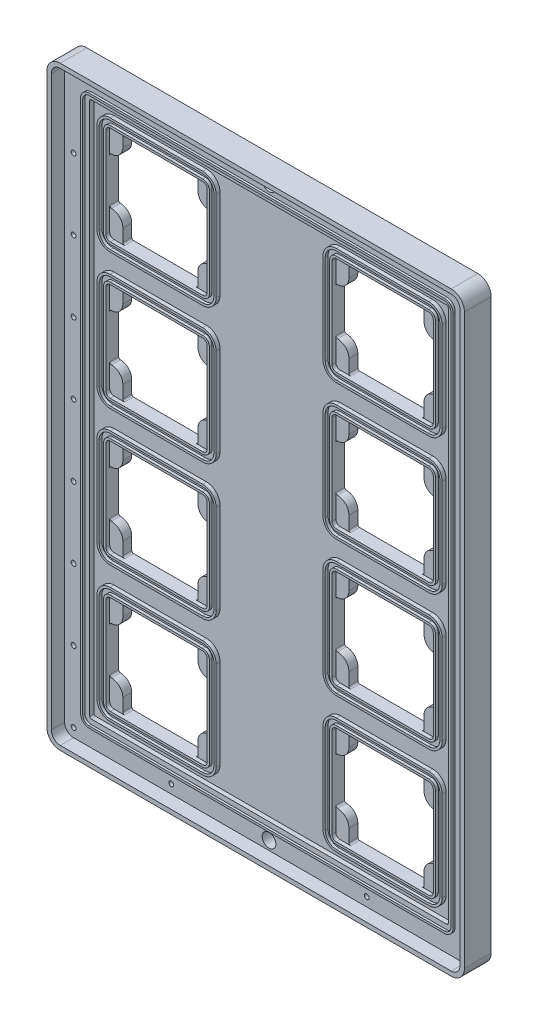
from build123d import *

# Parameters (mm, degrees)
SKETCH1_W            = 292.1
SKETCH1_H            = 419.1
BOSS_EXTRUDE1_DEPTH  = 9.525
SKETCH4_R            = 1.7272
CUT_EXTRUDE1_DEPTH   = 6.985
LPATTERN2_COUNT      = 8
LPATTERN2_PITCH      = 50.8
LPATTERN3_COUNT      = 4
LPATTERN3_PITCH      = 69.85
CUT_EXTRUDE3_DEPTH   = 3.175
BOSS_EXTRUDE2_DEPTH  = 1.5875
SKETCH7_R            = 4.9022
CUT_EXTRUDE4_DEPTH   = 511.938299235
FILLET1_R            = 6.35
CUT_EXTRUDE5_DEPTH   = 3.175
CUT_EXTRUDE6_DEPTH   = 511.970358882
SKETCH11_R           = 1.1303
CUT_EXTRUDE7_DEPTH   = 3.96875
BOSS_EXTRUDE3_DEPTH  = 2.794
BOSS_EXTRUDE4_DEPTH  = 0.79375
LPATTERN1_COUNT      = 2
LPATTERN1_PITCH      = 161.5948
LPATTERN1_COUNT_DIR2 = 4
LPATTERN1_PITCH_DIR2 = 96.8756
BOSS_EXTRUDE5_START  = -19.05
BOSS_EXTRUDE5_DEPTH  = 19.05


with BuildPart() as part:
    # Sketch1 → Boss-Extrude1 (new body)
    with BuildSketch(Plane.XY):
        with Locations((146.05, 209.55)):
            Rectangle(SKETCH1_W, SKETCH1_H)
    extrude(amount=BOSS_EXTRUDE1_DEPTH)

    # Sketch4 → Cut-Extrude1 (cut)
    with BuildSketch(Plane.XY.offset(9.525)):
        with Locations((6.35, 6.35)):
            Circle(SKETCH4_R)
        with Locations((6.35, 412.75)):
            Circle(SKETCH4_R)
        with Locations((285.75, 412.75)):
            Circle(SKETCH4_R)
        with Locations((285.75, 6.35)):
            Circle(SKETCH4_R)
    cut_extrude1 = extrude(amount=-CUT_EXTRUDE1_DEPTH, mode=Mode.SUBTRACT)

    # LPattern2: Cut-Extrude1 ×8
    with Locations(*[(0, -i * LPATTERN2_PITCH, 0) for i in range(1, LPATTERN2_COUNT)]):
        add(cut_extrude1, mode=Mode.SUBTRACT)

    # LPattern3: Cut-Extrude1 ×4
    with Locations(*[(-i * LPATTERN3_PITCH, 0, 0) for i in range(1, LPATTERN3_COUNT)]):
        add(cut_extrude1, mode=Mode.SUBTRACT)

    # Sketch6 → Cut-Extrude3 (cut)
    with BuildSketch(Plane.XY.offset(9.525)):
        with BuildLine():
            Line((273.05, 401.193), (19.05, 401.193))
            ThreePointArc((19.05, 401.193), (18.241776949, 400.858223051), (17.907, 400.05))
            Line((17.907, 400.05), (17.907, 19.05))
            ThreePointArc((17.907, 19.05), (18.241776949, 18.241776949), (19.05, 17.907))
            Line((19.05, 17.907), (273.05, 17.907))
            ThreePointArc((273.05, 17.907), (273.858223051, 18.241776949), (274.193, 19.05))
            Line((274.193, 19.05), (274.193, 400.05))
            ThreePointArc((274.193, 400.05), (273.858223051, 400.858223051), (273.05, 401.193))
        make_face()
    extrude(amount=-CUT_EXTRUDE3_DEPTH, mode=Mode.SUBTRACT)

    # Sketch5 → Boss-Extrude2 (add)
    with BuildSketch(Plane.XY.offset(9.525)):
        with BuildLine():
            ThreePointArc((19.05, 406.146), (14.739477062, 404.360522938), (12.954, 400.05))
            Line((12.954, 400.05), (12.954, 19.05))
            ThreePointArc((12.954, 19.05), (14.739477062, 14.739477062), (19.05, 12.954))
            Line((19.05, 12.954), (273.05, 12.954))
            ThreePointArc((273.05, 12.954), (277.360522938, 14.739477062), (279.146, 19.05))
            Line((279.146, 19.05), (279.146, 400.05))
            ThreePointArc((279.146, 400.05), (277.360522938, 404.360522938), (273.05, 406.146))
            Line((273.05, 406.146), (19.05, 406.146))
        make_face()
        with BuildLine():
            ThreePointArc((273.05, 404.622), (276.282892204, 403.282892204), (277.622, 400.05))
            Line((277.622, 400.05), (277.622, 19.05))
            ThreePointArc((277.622, 19.05), (276.282892204, 15.817107796), (273.05, 14.478))
            Line((273.05, 14.478), (19.05, 14.478))
            ThreePointArc((19.05, 14.478), (15.817107796, 15.817107796), (14.478, 19.05))
            Line((14.478, 19.05), (14.478, 400.05))
            ThreePointArc((14.478, 400.05), (15.817107796, 403.282892204), (19.05, 404.622))
            Line((19.05, 404.622), (273.05, 404.622))
        make_face(mode=Mode.SUBTRACT)
    extrude(amount=BOSS_EXTRUDE2_DEPTH)

    # Sketch7 → Cut-Extrude4 (cut, through all)
    with BuildSketch(Plane.XY.offset(9.525)):
        with Locations((146.05, 6.35)):
            Circle(SKETCH7_R)
        with Locations((146.05, 412.75)):
            Circle(SKETCH7_R)
    extrude(amount=-CUT_EXTRUDE4_DEPTH, mode=Mode.SUBTRACT)

    # Fillet1
    fillet1_edges = [part.edges().sort_by_distance(p)[0] for p in [
        (0, 419.1, 4.7625),
        (292.1, 419.1, 4.7625),
        (0, 0, 4.7625),
        (292.1, 0, 4.7625),
    ]]
    fillet(fillet1_edges, radius=FILLET1_R)

    # Sketch8 → Cut-Extrude5 (cut)
    with BuildSketch(Plane(origin=(0, 0, 0), x_dir=(-1, 0, 0), z_dir=(0, 0, -1))):
        with BuildLine():
            Line((-201.2442, 393.7), (-252.4506, 393.7))
            ThreePointArc((-252.4506, 393.7), (-255.881057838, 392.279057838), (-257.302, 388.8486))
            Line((-257.302, 388.8486), (-257.302, 379.857))
            ThreePointArc((-257.302, 379.857), (-258.633668309, 376.642068309), (-261.8486, 375.3104))
            ThreePointArc((-261.8486, 375.3104), (-265.279057838, 373.889457838), (-266.7, 370.459))
            Line((-266.7, 370.459), (-266.7, 339.2678))
            ThreePointArc((-266.7, 339.2678), (-265.279057838, 335.837342162), (-261.8486, 334.4164))
            ThreePointArc((-261.8486, 334.4164), (-258.633668309, 333.084731691), (-257.302, 329.8698))
            Line((-257.302, 329.8698), (-257.302, 320.8782))
            ThreePointArc((-257.302, 320.8782), (-255.881057838, 317.447742162), (-252.4506, 316.0268))
            Line((-252.4506, 316.0268), (-201.2442, 316.0268))
            ThreePointArc((-201.2442, 316.0268), (-197.813742162, 317.447742162), (-196.3928, 320.8782))
            Line((-196.3928, 320.8782), (-196.3928, 329.8698))
            ThreePointArc((-196.3928, 329.8698), (-195.061131691, 333.084731691), (-191.8462, 334.4164))
            ThreePointArc((-191.8462, 334.4164), (-188.415742162, 335.837342162), (-186.9948, 339.2678))
            Line((-186.9948, 339.2678), (-186.9948, 370.459))
            ThreePointArc((-186.9948, 370.459), (-188.415742162, 373.889457838), (-191.8462, 375.3104))
            ThreePointArc((-191.8462, 375.3104), (-195.061131691, 376.642068309), (-196.3928, 379.857))
            Line((-196.3928, 379.857), (-196.3928, 388.8486))
            ThreePointArc((-196.3928, 388.8486), (-197.813742162, 392.279057838), (-201.2442, 393.7))
        make_face()
        with BuildLine():
            Line((-264.668, 370.459), (-264.668, 339.2678))
            ThreePointArc((-264.668, 339.2678), (-263.842216859, 337.274183141), (-261.8486, 336.4484))
            ThreePointArc((-261.8486, 336.4484), (-257.196827329, 334.521572671), (-255.27, 329.8698))
            Line((-255.27, 329.8698), (-255.27, 320.8782))
            ThreePointArc((-255.27, 320.8782), (-254.444216859, 318.884583141), (-252.4506, 318.0588))
            Line((-252.4506, 318.0588), (-201.2442, 318.0588))
            ThreePointArc((-201.2442, 318.0588), (-199.250583141, 318.884583141), (-198.4248, 320.8782))
            Line((-198.4248, 320.8782), (-198.4248, 329.8698))
            ThreePointArc((-198.4248, 329.8698), (-196.497972671, 334.521572671), (-191.8462, 336.4484))
            ThreePointArc((-191.8462, 336.4484), (-189.852583141, 337.274183141), (-189.0268, 339.2678))
            Line((-189.0268, 339.2678), (-189.0268, 370.459))
            ThreePointArc((-189.0268, 370.459), (-189.852583141, 372.452616859), (-191.8462, 373.2784))
            ThreePointArc((-191.8462, 373.2784), (-196.497972671, 375.205227329), (-198.4248, 379.857))
            Line((-198.4248, 379.857), (-198.4248, 388.8486))
            ThreePointArc((-198.4248, 388.8486), (-199.250583141, 390.842216859), (-201.2442, 391.668))
            Line((-201.2442, 391.668), (-252.4506, 391.668))
            ThreePointArc((-252.4506, 391.668), (-254.444216859, 390.842216859), (-255.27, 388.8486))
            Line((-255.27, 388.8486), (-255.27, 379.857))
            ThreePointArc((-255.27, 379.857), (-257.196827329, 375.205227329), (-261.8486, 373.2784))
            ThreePointArc((-261.8486, 373.2784), (-263.842216859, 372.452616859), (-264.668, 370.459))
        make_face(mode=Mode.SUBTRACT)
    cut_extrude5 = extrude(amount=-CUT_EXTRUDE5_DEPTH, mode=Mode.SUBTRACT)

    # Sketch10 → Cut-Extrude6 (cut, through all)
    with BuildSketch(Plane(origin=(0, 0, 0), x_dir=(-1, 0, 0), z_dir=(0, 0, -1))):
        with BuildLine():
            Line((-263.0805, 370.459), (-263.0805, 339.2678))
            ThreePointArc((-263.0805, 339.2678), (-262.719684844, 338.396715156), (-261.8486, 338.0359))
            ThreePointArc((-261.8486, 338.0359), (-256.074295314, 335.644104686), (-253.6825, 329.8698))
            Line((-253.6825, 329.8698), (-253.6825, 320.8782))
            ThreePointArc((-253.6825, 320.8782), (-253.321684844, 320.007115156), (-252.4506, 319.6463))
            Line((-252.4506, 319.6463), (-201.2442, 319.6463))
            ThreePointArc((-201.2442, 319.6463), (-200.373115156, 320.007115156), (-200.0123, 320.8782))
            Line((-200.0123, 320.8782), (-200.0123, 329.8698))
            ThreePointArc((-200.0123, 329.8698), (-197.620504686, 335.644104686), (-191.8462, 338.0359))
            ThreePointArc((-191.8462, 338.0359), (-190.975115156, 338.396715156), (-190.6143, 339.2678))
            Line((-190.6143, 339.2678), (-190.6143, 370.459))
            ThreePointArc((-190.6143, 370.459), (-190.975115156, 371.330084844), (-191.8462, 371.6909))
            ThreePointArc((-191.8462, 371.6909), (-197.620504686, 374.082695314), (-200.0123, 379.857))
            Line((-200.0123, 379.857), (-200.0123, 388.8486))
            ThreePointArc((-200.0123, 388.8486), (-200.373115156, 389.719684844), (-201.2442, 390.0805))
            Line((-201.2442, 390.0805), (-252.4506, 390.0805))
            ThreePointArc((-252.4506, 390.0805), (-253.321684844, 389.719684844), (-253.6825, 388.8486))
            Line((-253.6825, 388.8486), (-253.6825, 379.857))
            ThreePointArc((-253.6825, 379.857), (-256.074295314, 374.082695314), (-261.8486, 371.6909))
            ThreePointArc((-261.8486, 371.6909), (-262.719684844, 371.330084844), (-263.0805, 370.459))
        make_face()
    cut_extrude6 = extrude(amount=-CUT_EXTRUDE6_DEPTH, mode=Mode.SUBTRACT)

    # Sketch11 → Cut-Extrude7 (cut)
    with BuildSketch(Plane(origin=(0, 0, 0), x_dir=(-1, 0, 0), z_dir=(0, 0, -1))):
        with Locations((-261.8486, 388.8994)):
            Circle(SKETCH11_R)
        with Locations((-191.8462, 388.8994)):
            Circle(SKETCH11_R)
        with Locations((-191.8462, 320.8274)):
            Circle(SKETCH11_R)
        with Locations((-261.8486, 320.8274)):
            Circle(SKETCH11_R)
    cut_extrude7 = extrude(amount=-CUT_EXTRUDE7_DEPTH, mode=Mode.SUBTRACT)

    # Sketch12 → Boss-Extrude3 (add)
    # profile 1 of 2: a face of its own
    with BuildSketch(Plane.XY.offset(6.35)):
        with BuildLine():
            ThreePointArc((193.7893, 396.4305), (187.054107909, 393.640692091), (184.2643, 386.9055))
            Line((184.2643, 386.9055), (184.2643, 322.8213))
            ThreePointArc((184.2643, 322.8213), (187.054107909, 316.086107909), (193.7893, 313.2963))
            Line((193.7893, 313.2963), (259.9055, 313.2963))
            ThreePointArc((259.9055, 313.2963), (266.640692091, 316.086107909), (269.4305, 322.8213))
            Line((269.4305, 322.8213), (269.4305, 386.9055))
            ThreePointArc((269.4305, 386.9055), (266.640692091, 393.640692091), (259.9055, 396.4305))
            Line((259.9055, 396.4305), (193.7893, 396.4305))
        make_face()
        with BuildLine():
            Line((185.8518, 322.8213), (185.8518, 386.9055))
            ThreePointArc((185.8518, 386.9055), (188.176639924, 392.518160076), (193.7893, 394.843))
            Line((193.7893, 394.843), (259.9055, 394.843))
            ThreePointArc((259.9055, 394.843), (265.518160076, 392.518160076), (267.843, 386.9055))
            Line((267.843, 386.9055), (267.843, 322.8213))
            ThreePointArc((267.843, 322.8213), (265.518160076, 317.208639924), (259.9055, 314.8838))
            Line((259.9055, 314.8838), (193.7893, 314.8838))
            ThreePointArc((193.7893, 314.8838), (188.176639924, 317.208639924), (185.8518, 322.8213))
        make_face(mode=Mode.SUBTRACT)
    # profile 2 of 2: a face of its own
    with BuildSketch(Plane.XY.offset(6.35)):
        with BuildLine():
            Line((259.9055, 391.668), (193.7893, 391.668))
            ThreePointArc((193.7893, 391.668), (190.421703955, 390.273096045), (189.0268, 386.9055))
            Line((189.0268, 386.9055), (189.0268, 322.8213))
            ThreePointArc((189.0268, 322.8213), (190.421703955, 319.453703955), (193.7893, 318.0588))
            Line((193.7893, 318.0588), (259.9055, 318.0588))
            ThreePointArc((259.9055, 318.0588), (263.273096045, 319.453703955), (264.668, 322.8213))
            Line((264.668, 322.8213), (264.668, 386.9055))
            ThreePointArc((264.668, 386.9055), (263.273096045, 390.273096045), (259.9055, 391.668))
        make_face()
        with BuildLine():
            ThreePointArc((190.6143, 386.9055), (191.54423597, 389.15056403), (193.7893, 390.0805))
            Line((193.7893, 390.0805), (259.9055, 390.0805))
            ThreePointArc((259.9055, 390.0805), (262.15056403, 389.15056403), (263.0805, 386.9055))
            Line((263.0805, 386.9055), (263.0805, 322.8213))
            ThreePointArc((263.0805, 322.8213), (262.15056403, 320.57623597), (259.9055, 319.6463))
            Line((259.9055, 319.6463), (193.7893, 319.6463))
            ThreePointArc((193.7893, 319.6463), (191.54423597, 320.57623597), (190.6143, 322.8213))
            Line((190.6143, 322.8213), (190.6143, 386.9055))
        make_face(mode=Mode.SUBTRACT)
    boss_extrude3 = extrude(amount=BOSS_EXTRUDE3_DEPTH)

    # Sketch12<3> → Boss-Extrude4 (add)
    with BuildSketch(Plane.XY.offset(6.35)):
        with BuildLine():
            ThreePointArc((193.7893, 394.843), (188.176639924, 392.518160076), (185.8518, 386.9055))
            Line((185.8518, 386.9055), (185.8518, 322.8213))
            ThreePointArc((185.8518, 322.8213), (188.176639924, 317.208639924), (193.7893, 314.8838))
            Line((193.7893, 314.8838), (259.9055, 314.8838))
            ThreePointArc((259.9055, 314.8838), (265.518160076, 317.208639924), (267.843, 322.8213))
            Line((267.843, 322.8213), (267.843, 386.9055))
            ThreePointArc((267.843, 386.9055), (265.518160076, 392.518160076), (259.9055, 394.843))
            Line((259.9055, 394.843), (193.7893, 394.843))
        make_face()
        with BuildLine():
            ThreePointArc((189.0268, 386.9055), (190.421703955, 390.273096045), (193.7893, 391.668))
            Line((193.7893, 391.668), (259.9055, 391.668))
            ThreePointArc((259.9055, 391.668), (263.273096045, 390.273096045), (264.668, 386.9055))
            Line((264.668, 386.9055), (264.668, 322.8213))
            ThreePointArc((264.668, 322.8213), (263.273096045, 319.453703955), (259.9055, 318.0588))
            Line((259.9055, 318.0588), (193.7893, 318.0588))
            ThreePointArc((193.7893, 318.0588), (190.421703955, 319.453703955), (189.0268, 322.8213))
            Line((189.0268, 322.8213), (189.0268, 386.9055))
        make_face(mode=Mode.SUBTRACT)
    boss_extrude4 = extrude(amount=BOSS_EXTRUDE4_DEPTH)

    # LPattern1: Cut-Extrude5, Cut-Extrude6, Cut-Extrude7, Boss-Extrude3, Boss-Extrude4 2 × 4
    with Locations(*[(-i * LPATTERN1_PITCH, -j * LPATTERN1_PITCH_DIR2, 0) for i in range(LPATTERN1_COUNT) for j in range(LPATTERN1_COUNT_DIR2) if (i, j) != (0, 0)]):
        add(cut_extrude5, mode=Mode.SUBTRACT)
        add(cut_extrude6, mode=Mode.SUBTRACT)
        add(cut_extrude7, mode=Mode.SUBTRACT)
        add(boss_extrude3)
        add(boss_extrude4)

    # Sketch13 → Boss-Extrude5 (add)
    with BuildSketch(Plane(origin=(0, 0, 0), x_dir=(-1, 0, 0), z_dir=(0, 0, -1)).offset(BOSS_EXTRUDE5_START)):
        with BuildLine():
            Line((-285.75, -3.175), (-6.35, -3.175))
            ThreePointArc((-6.35, -3.175), (0.385192091, -0.385192091), (3.175, 6.35))
            Line((3.175, 6.35), (3.175, 412.75))
            ThreePointArc((3.175, 412.75), (0.385192091, 419.485192091), (-6.35, 422.275))
            Line((-6.35, 422.275), (-285.75, 422.275))
            ThreePointArc((-285.75, 422.275), (-292.485192091, 419.485192091), (-295.275, 412.75))
            Line((-295.275, 412.75), (-295.275, 6.35))
            ThreePointArc((-295.275, 6.35), (-292.485192091, -0.385192091), (-285.75, -3.175))
        make_face()
        with BuildLine():
            Line((-6.35, 419.1), (-285.75, 419.1))
            ThreePointArc((-285.75, 419.1), (-290.240128061, 417.240128061), (-292.1, 412.75))
            Line((-292.1, 412.75), (-292.1, 6.35))
            ThreePointArc((-292.1, 6.35), (-290.240128061, 1.859871939), (-285.75, 0))
            Line((-285.75, 0), (-6.35, 0))
            ThreePointArc((-6.35, 0), (-1.859871939, 1.859871939), (0, 6.35))
            Line((0, 6.35), (0, 412.75))
            ThreePointArc((0, 412.75), (-1.859871939, 417.240128061), (-6.35, 419.1))
        make_face(mode=Mode.SUBTRACT)
    extrude(amount=BOSS_EXTRUDE5_DEPTH)


solid = part.part
